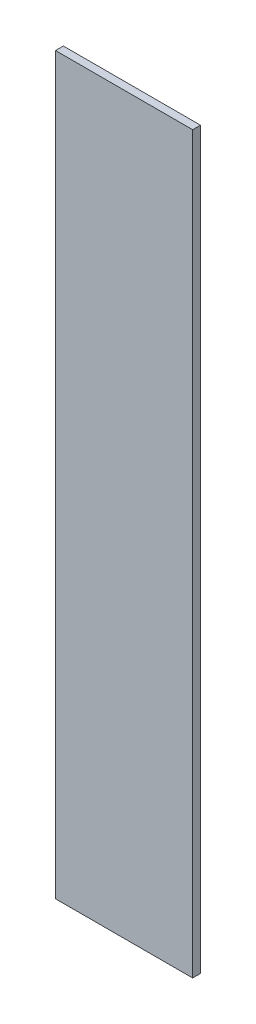
from build123d import *

# Parameters (mm, degrees)
SKETCH1_W           = 28
SKETCH1_H           = 150
BOSS_EXTRUDE1_DEPTH = 1.6


with BuildPart() as part:
    # Sketch1 → Boss-Extrude1 (new body)
    with BuildSketch(Plane.XY):
        with Locations((0, 75)):
            Rectangle(SKETCH1_W, SKETCH1_H)
    extrude(amount=BOSS_EXTRUDE1_DEPTH)


solid = part.part
